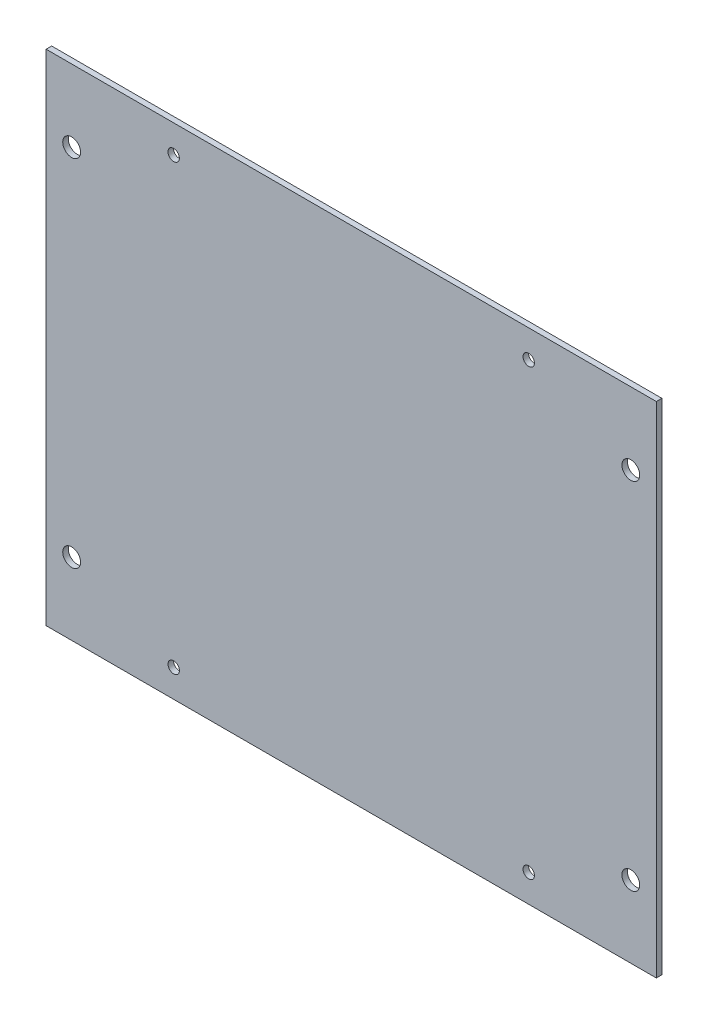
from build123d import *

# Parameters (mm, degrees)
SKETCH3_W              = 914.4
SKETCH3_H              = 609.6
BOSS_EXTRUDE1_DEPTH    = 0.79375
SKETCH4_OUTSIDE_W      = 1136.194
SKETCH4_OUTSIDE_H      = 831.394
CUT_EXTRUDE1_DEPTH     = 2.54
F_4_CLEARANCE_HOLE1_D  = 3.2639
F_10_CLEARANCE_HOLE1_D = 5.1054


with BuildPart() as part:
    # Sketch3 → Boss-Extrude1 (new, symmetric)
    with BuildSketch(Plane.XY):
        Rectangle(SKETCH3_W, SKETCH3_H)
    extrude(amount=BOSS_EXTRUDE1_DEPTH, both=True)

    # Sketch4 outside → Cut-Extrude1 (cut)
    with BuildSketch(Plane(origin=(0, 0, -0.79375), x_dir=(-1, 0, 0), z_dir=(0, 0, -1))):
        Rectangle(SKETCH4_OUTSIDE_W, SKETCH4_OUTSIDE_H)
        Polygon((393.203802185, -83.309137785), (218.578811797, -83.308537798), (218.578811797, 59.566462202), (393.203802185, 59.565862215), align=None, mode=Mode.SUBTRACT)
    extrude(amount=-CUT_EXTRUDE1_DEPTH, mode=Mode.SUBTRACT)

    # #4 Clearance Hole1 (through all)
    with Locations(Plane(origin=(0, 0, -0.79375), x_dir=(-1, 0, 0), z_dir=(0, 0, -1))):
        with Locations((255.091306991, -75.371037798), (356.691306991, -75.371337792), (356.709634991, 51.603562202), (255.091306991, 51.628962221)):
            Hole(F_4_CLEARANCE_HOLE1_D / 2)

    # #10 Clearance Hole1 (through all)
    with Locations(Plane(origin=(0, 0, -0.79375), x_dir=(-1, 0, 0), z_dir=(0, 0, -1))):
        with Locations((225.881311797, -62.671337791), (225.881311797, 38.928662209), (385.901302185, 38.928662208), (385.901302185, -62.671337792)):
            Hole(F_10_CLEARANCE_HOLE1_D / 2)


solid = part.part
